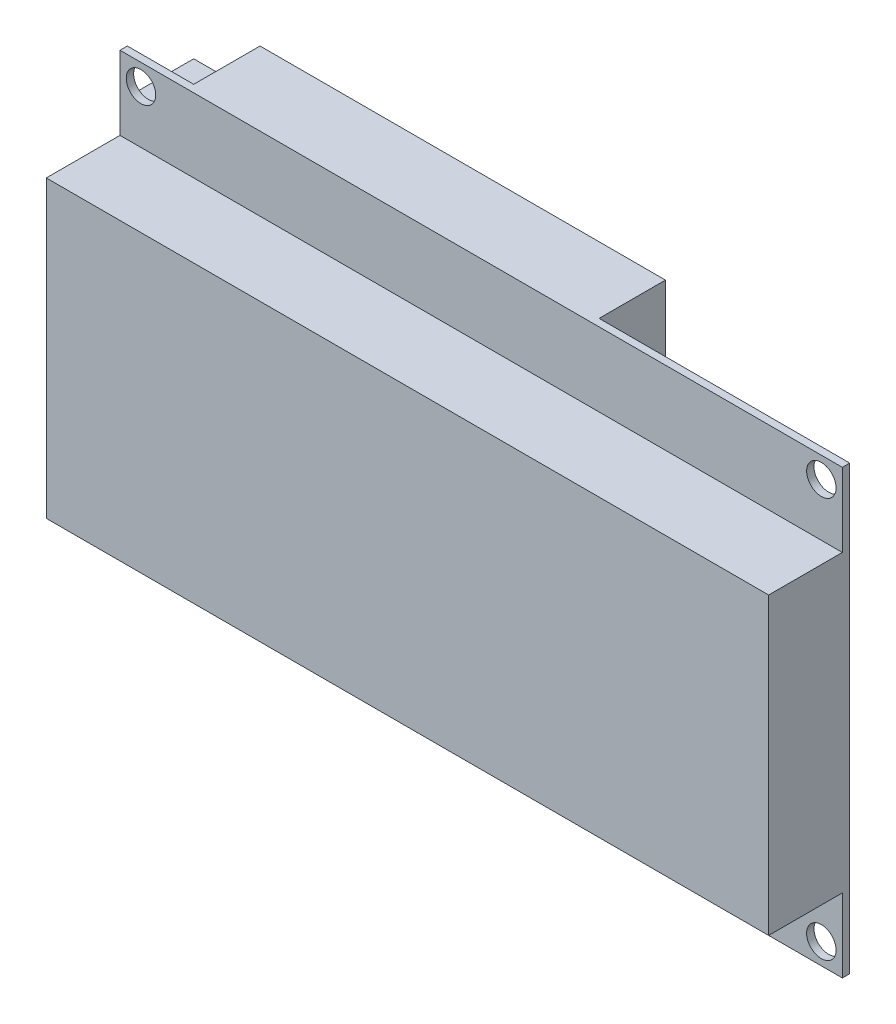
from build123d import *

# Parameters (mm, degrees)
ESQUISSE1_W             = 98
ESQUISSE1_H             = 60
BOSS_EXTRU_1_DEPTH      = 11
ESQUISSE2_W             = 98
ESQUISSE2_H             = 10
ENL_V_MAT_EXTRU_1_DEPTH = 10
BOSS_EXTRU_2_DEPTH      = 9
ENL_V_MAT_EXTRU_2_REACH = 117.343
ESQUISSE4_R             = 2


with BuildPart() as part:
    # Esquisse1 → Boss.-Extru.1 (new body)
    with BuildSketch(Plane.XY):
        with Locations((49, 30)):
            Rectangle(ESQUISSE1_W, ESQUISSE1_H)
    extrude(amount=-BOSS_EXTRU_1_DEPTH)

    # Esquisse2 → Enlèv. mat.-Extru.1 (cut)
    with BuildSketch(Plane.XY):
        with Locations((49, 55)):
            Rectangle(ESQUISSE2_W, ESQUISSE2_H)
        with Locations((49, 5)):
            Rectangle(ESQUISSE2_W, ESQUISSE2_H)
    extrude(amount=-ENL_V_MAT_EXTRU_1_DEPTH, mode=Mode.SUBTRACT)

    # Esquisse3 → Boss.-Extru.2 (add)
    with BuildSketch(Plane(origin=(0, 0, -11), x_dir=(-1, 0, 0), z_dir=(0, 0, -1))):
        Polygon((-9, 60), (-64, 60), (-64, 40), (-9, 40), (-9, 45), (0, 45), (0, 54), (-9, 54), align=None)
    extrude(amount=BOSS_EXTRU_2_DEPTH)

    # Esquisse4 → Enlèv. mat.-Extru.2 (cut, up to next)
    with BuildSketch(Plane.XY.offset(-10), mode=Mode.PRIVATE) as enl_v_mat_extru_2_sk1:
        with Locations((2.85, 57.15)):
            Circle(ESQUISSE4_R)
    enl_v_mat_extru_2_tool1 = extrude(enl_v_mat_extru_2_sk1.sketch, amount=-ENL_V_MAT_EXTRU_2_REACH, mode=Mode.PRIVATE) & part.part
    # Esquisse4 → Enlèv. mat.-Extru.2 (cut, up to next)
    with BuildSketch(Plane.XY.offset(-10), mode=Mode.PRIVATE) as enl_v_mat_extru_2_sk2:
        with Locations((95.15, 57.15)):
            Circle(ESQUISSE4_R)
    enl_v_mat_extru_2_tool2 = extrude(enl_v_mat_extru_2_sk2.sketch, amount=-ENL_V_MAT_EXTRU_2_REACH, mode=Mode.PRIVATE) & part.part
    # Esquisse4 → Enlèv. mat.-Extru.2 (cut, up to next)
    with BuildSketch(Plane.XY.offset(-10), mode=Mode.PRIVATE) as enl_v_mat_extru_2_sk3:
        with Locations((95.15, 2.85)):
            Circle(ESQUISSE4_R)
    enl_v_mat_extru_2_tool3 = extrude(enl_v_mat_extru_2_sk3.sketch, amount=-ENL_V_MAT_EXTRU_2_REACH, mode=Mode.PRIVATE) & part.part
    # Esquisse4 → Enlèv. mat.-Extru.2 (cut, up to next)
    with BuildSketch(Plane.XY.offset(-10), mode=Mode.PRIVATE) as enl_v_mat_extru_2_sk4:
        with Locations((2.85, 2.85)):
            Circle(ESQUISSE4_R)
    enl_v_mat_extru_2_tool4 = extrude(enl_v_mat_extru_2_sk4.sketch, amount=-ENL_V_MAT_EXTRU_2_REACH, mode=Mode.PRIVATE) & part.part
    add(enl_v_mat_extru_2_tool1.solids().sort_by_distance((2.85, 57.15, -10))[0], mode=Mode.SUBTRACT)
    add(enl_v_mat_extru_2_tool2.solids().sort_by_distance((95.15, 57.15, -10))[0], mode=Mode.SUBTRACT)
    add(enl_v_mat_extru_2_tool3.solids().sort_by_distance((95.15, 2.85, -10))[0], mode=Mode.SUBTRACT)
    add(enl_v_mat_extru_2_tool4.solids().sort_by_distance((2.85, 2.85, -10))[0], mode=Mode.SUBTRACT)


solid = part.part
